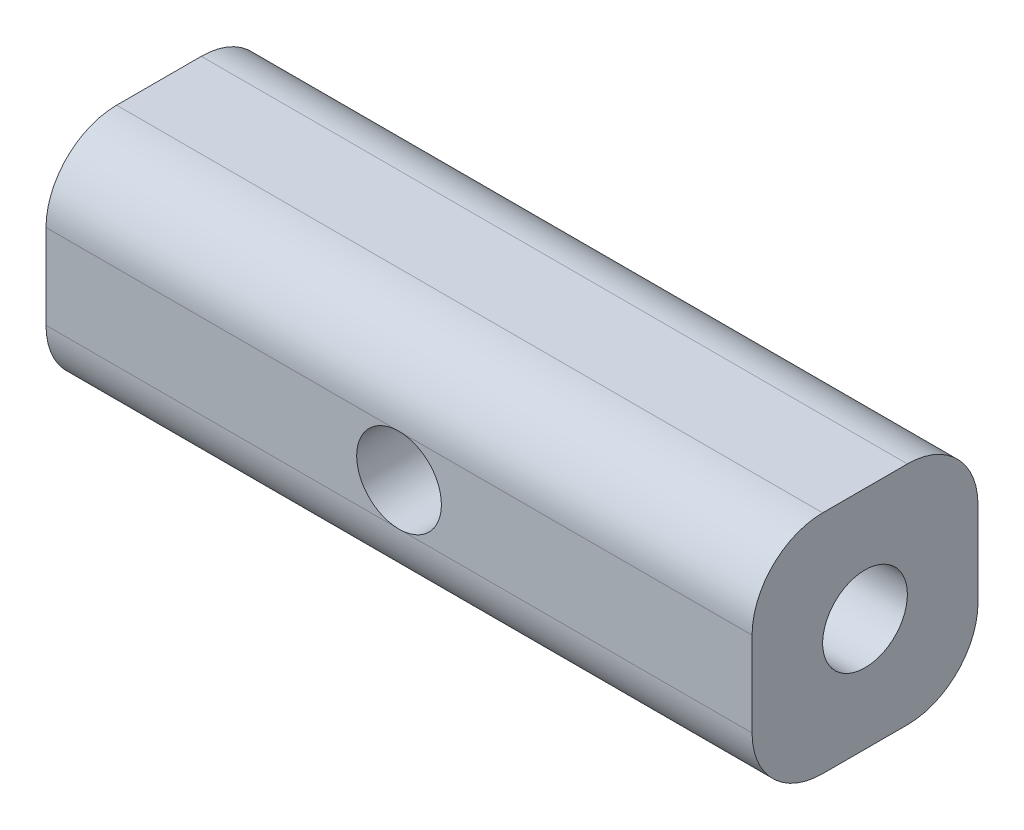
from build123d import *

# Parameters (mm, degrees)
ESQUISSE1_W             = 250
ESQUISSE1_H             = 80
BOSS_EXTRU_1_DEPTH      = 80
ESQUISSE2_R             = 15
ENL_V_MAT_EXTRU_1_DEPTH = 275.40845468
ESQUISSE3_R             = 15
ENL_V_MAT_EXTRU_2_DEPTH = 80
CONG_1_R                = 25


with BuildPart() as part:
    # Esquisse1 → Boss.-Extru.1 (new body)
    with BuildSketch(Plane.XY):
        with Locations((125, 40)):
            Rectangle(ESQUISSE1_W, ESQUISSE1_H)
    extrude(amount=BOSS_EXTRU_1_DEPTH)

    # Esquisse2 → Enlèv. mat.-Extru.1 (cut, through all)
    with BuildSketch(Plane(origin=(250, 0, 0), x_dir=(0, 0, -1), z_dir=(1, 0, 0))):
        with Locations((-40, 40)):
            Circle(ESQUISSE2_R)
    extrude(amount=-ENL_V_MAT_EXTRU_1_DEPTH, mode=Mode.SUBTRACT)

    # Esquisse3 → Enlèv. mat.-Extru.2 (cut)
    with BuildSketch(Plane.XY.offset(80)):
        with Locations((125, 40)):
            Circle(ESQUISSE3_R)
    extrude(amount=-ENL_V_MAT_EXTRU_2_DEPTH, mode=Mode.SUBTRACT)

    # Congé1
    cong_1_edges = [part.edges().sort_by_distance(p)[0] for p in [
        (125, 80, 80),
        (125, 80, 0),
        (125, 0, 0),
        (125, 0, 80),
    ]]
    fillet(cong_1_edges, radius=CONG_1_R - 0.0001)  # a hair under: the kernel refuses the full size


solid = part.part
